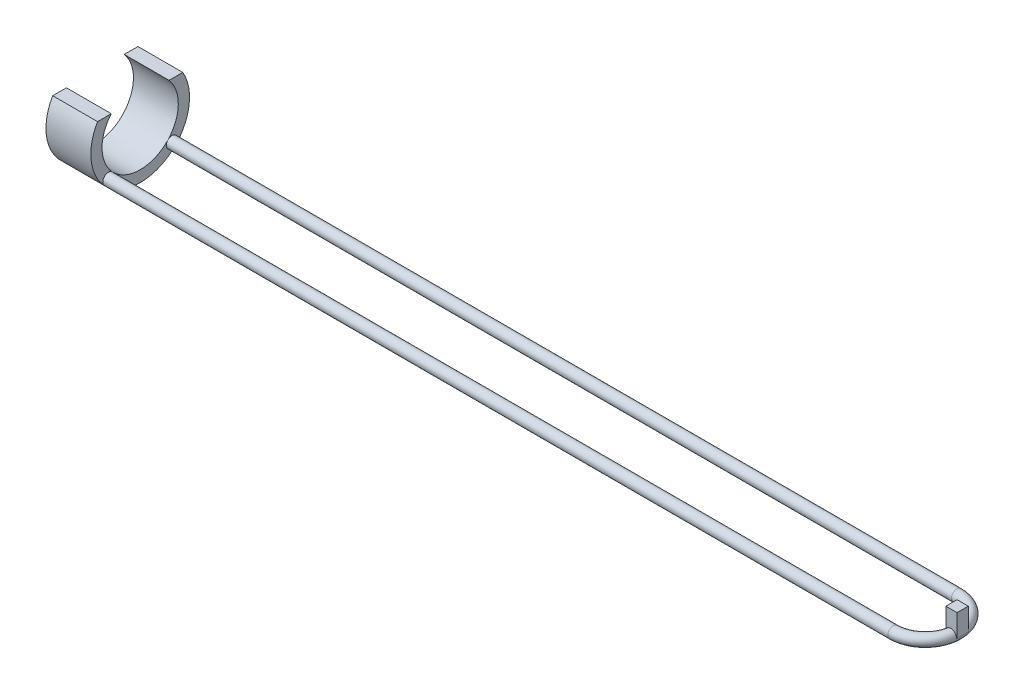
from build123d import *

# Parameters (mm, degrees)
SKETCH1_R             = 2.5
BOSS_EXTRUDE1_DEPTH   = 350
BOSS_EXTRUDE1_2_DEPTH = 350
REVOLVE1_OUTLINE_R    = 2.5
REVOLVE1_ANGLE        = 180
SKETCH4_W             = 5
SKETCH4_H             = 10
BOSS_EXTRUDE2_DEPTH   = 5
BOSS_EXTRUDE3_DEPTH   = 20


# Read off the part's stored shape, not the designer's step: Revolve1
with BuildPart() as part:
    # Sketch1 → Boss-Extrude1 (new body)
    with BuildSketch(Plane(origin=(0, 0, 0), x_dir=(0, 0, -1), z_dir=(1, 0, 0))):
        with Locations((14.171822198, -11.891570779)):
            Circle(SKETCH1_R)
    extrude(amount=BOSS_EXTRUDE1_DEPTH)



with BuildPart() as body_2:
    # Sketch1 → Boss-Extrude1 2 (new body)
    with BuildSketch(Plane(origin=(0, 0, 0), x_dir=(0, 0, -1), z_dir=(1, 0, 0))):
        with Locations((-14.171822198, -11.891570779)):
            Circle(SKETCH1_R)
    extrude(amount=BOSS_EXTRUDE1_2_DEPTH)


with BuildPart() as part_1:
    add(part.part)

    add(body_2.part)  # Revolve1 merges body 2
    # Revolve1 outline → Revolve1 (revolve)
    with BuildSketch(Plane.ZY.offset(-350)):
        with Locations((14.171822198, -11.891570779)):
            Circle(REVOLVE1_OUTLINE_R)
    revolve(axis=Axis((350, 0, 0), (0, 1, 0)), revolution_arc=REVOLVE1_ANGLE)

    # Sketch5 → Boss-Extrude3 (add)
    with BuildSketch(Plane.ZY):
        with BuildLine():
            Line((-12.884098727, 12.593347221), (-19, 12.593347221))
            ThreePointArc((-19, 12.593347221), (0, -20.497189286), (19, 12.593347221))
            Line((19, 12.593347221), (12.884098727, 12.593347221))
            ThreePointArc((12.884098727, 12.593347221), (0, -15.497189286), (-12.884098727, 12.593347221))
        make_face()
    extrude(amount=BOSS_EXTRUDE3_DEPTH)


with BuildPart() as body_2_2:
    # Sketch4 → Boss-Extrude2 (new body)
    with BuildSketch(Plane(origin=(366.7, 0, 0), x_dir=(0, 0, -1), z_dir=(1, 0, 0))):
        with Locations((0, -6.891570779)):
            Rectangle(SKETCH4_W, SKETCH4_H)
    extrude(amount=-BOSS_EXTRUDE2_DEPTH)


solid = Compound([part_1.part, body_2_2.part])
